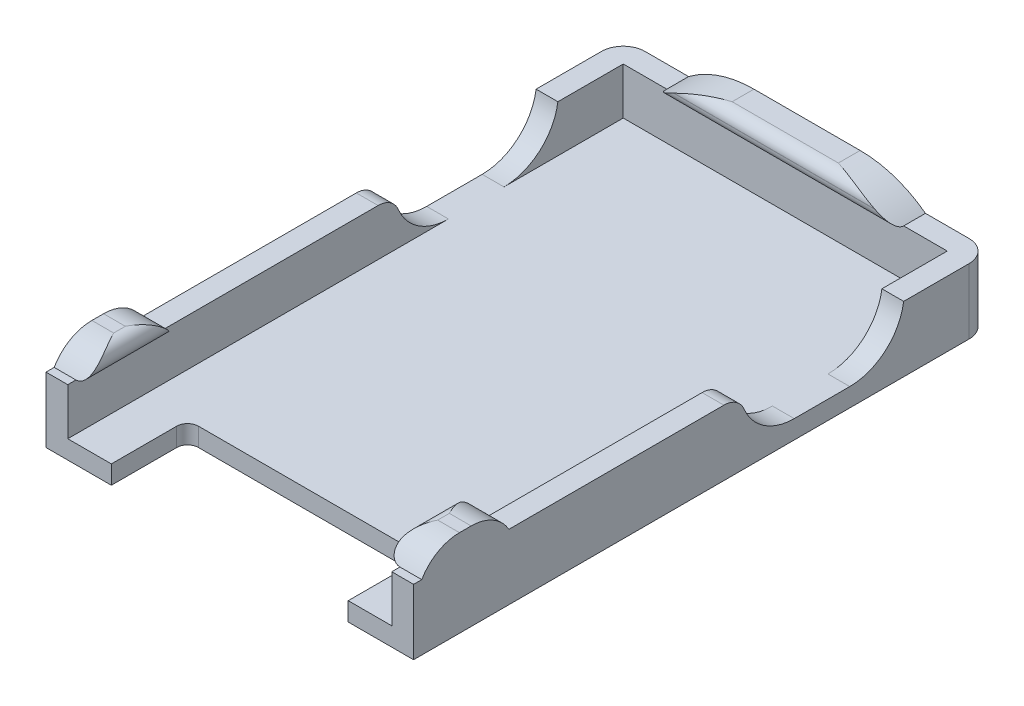
from build123d import *

# Parameters (mm, degrees)
SKETCH1_W               = 33.75000000000001
SKETCH1_H               = 55.99999999999999
SKETCH1_W_2             = 29.750000000000004
SKETCH1_H_2             = 52.00000000000001
BOSS_EXTRUDE1_DEPTH     = 6
BOSS_EXTRUDE2_DEPTH     = 1.7
SKETCH3_W               = 29.750000000000004
SKETCH3_H               = 4.3
CUT_EXTRUDE1_DEPTH      = 63.92902748334825
SKETCH5_W               = 21.750000000000004
SKETCH5_H               = 2.999999999999986
SKETCH5_W_2             = 2.9999999999999996
SKETCH5_H_2             = 8
BOSS_EXTRUDE3_DEPTH     = 2
CUT_EXTRUDE2_DEPTH      = 62.66137364671663
CUT_EXTRUDE2_DEPTH_BACK = 62.66137364671663
CUT_EXTRUDE3_DEPTH      = 62.66137364671663
CUT_EXTRUDE3_DEPTH_BACK = 62.66137364671663
CUT_EXTRUDE4_START      = -21.75
CUT_EXTRUDE4_DEPTH      = 21.75
FILLET1_R               = 10
FILLET2_R               = 4
CUT_EXTRUDE5_DEPTH      = 65.17992314238798
SKETCH12_W              = 21.750000000000004
SKETCH12_H              = 6.999999999999999
CUT_EXTRUDE6_DEPTH      = 63.958339642557306
FILLET4_R               = 2
FILLET5_R               = 1
CUT_EXTRUDE7_DEPTH      = 64.15110873264877
CUT_EXTRUDE7_DEPTH_BACK = 64.15110873264877
SKETCH13_W              = 14.999999999999996
SKETCH13_H              = 4.300000000000001
FILLET6_R               = 5
FILLET7_R               = 2


# Read off the part's stored shape, not the designer's step: Cut-Extrude4
with BuildPart() as part:
    # Sketch1 → Boss-Extrude1 (new body)
    with BuildSketch(Plane(origin=(0, 0, 0), x_dir=(1, 0, 0), z_dir=(0, 1, 0))):
        with Locations((14.875000000000002, 25.999999999999996)):
            Rectangle(SKETCH1_W, SKETCH1_H)
        with Locations((14.875000000000002, 26.000000000000004)):
            Rectangle(SKETCH1_W_2, SKETCH1_H_2, mode=Mode.SUBTRACT)
    extrude(amount=BOSS_EXTRUDE1_DEPTH)

    # Sketch2 → Boss-Extrude2 (add)
    with BuildSketch(Plane.XZ):
        Polygon((-1.9999999999999996, 2), (31.749999999999993, 2), (31.75, -53.99999999999999), (-1.9999999999999927, -53.99999999999999), align=None)
    extrude(amount=-BOSS_EXTRUDE2_DEPTH)

    # Sketch3 → Cut-Extrude1 (cut, through all)
    with BuildSketch(Plane(origin=(0, 0, 0), x_dir=(-1, 0, 0), z_dir=(0, 0, -1))):
        with Locations((-14.875000000000002, 3.85)):
            Rectangle(SKETCH3_W, SKETCH3_H)
    extrude(amount=-CUT_EXTRUDE1_DEPTH, mode=Mode.SUBTRACT)

    # Sketch5 → Boss-Extrude3 (add)
    with BuildSketch(Plane(origin=(0, 6, 0), x_dir=(1, 0, 0), z_dir=(0, 1, 0))):
        with Locations((14.875000000000002, 52.5)):
            Rectangle(SKETCH5_W, SKETCH5_H)
        with Locations((-0.4999999999999998, 5.75)):
            Rectangle(SKETCH5_W_2, SKETCH5_H_2)
        Polygon((31.750000000000014, 9.750000000000004), (28.75000000000001, 9.750000000000004), (28.750000000000014, 1.7500000000000033), (31.75000000000002, 1.750000000000004), align=None)
    extrude(amount=BOSS_EXTRUDE3_DEPTH)

    # Sketch6 → Cut-Extrude2 (cut, two sides: drawn at the far end of the back side and taken through both)
    with BuildSketch(Plane.XY.offset(-1.7499999999999998).offset(-CUT_EXTRUDE2_DEPTH_BACK)):
        with BuildLine():
            Line((1, 8), (0, 8))
            ThreePointArc((0, 8), (0.7071067811865474, 7.707106781186548), (1.0000000000000002, 7.000000000000001))
            Line((1, 7.000000000000001), (1, 8))
        make_face()
        with BuildLine():
            Line((1, 6), (1, 7.000000000000001))
            ThreePointArc((1.0000000000000002, 7.000000000000001), (0.7071067811865479, 6.292893218813453), (1.2e-16, 6))
            Line((0, 6), (1, 6))
        make_face()
    extrude(amount=CUT_EXTRUDE2_DEPTH + CUT_EXTRUDE2_DEPTH_BACK, mode=Mode.SUBTRACT)

    # Sketch7 → Cut-Extrude3 (cut, two sides: drawn at the far end of the back side and taken through both)
    with BuildSketch(Plane.XY.offset(-1.749999999999997).offset(-CUT_EXTRUDE3_DEPTH_BACK)):
        with BuildLine():
            Line((28.750000000000014, 6), (29.75, 6))
            ThreePointArc((29.75, 6), (29.042893218813454, 6.292893218813452), (28.75, 7))
            Line((28.750000000000014, 7), (28.750000000000014, 6))
        make_face()
        with BuildLine():
            Line((28.750000000000014, 8), (28.750000000000014, 7))
            ThreePointArc((28.75, 7), (29.042893218813454, 7.707106781186548), (29.75, 8))
            Line((29.75, 8), (28.750000000000014, 8))
        make_face()
    extrude(amount=CUT_EXTRUDE3_DEPTH + CUT_EXTRUDE3_DEPTH_BACK, mode=Mode.SUBTRACT)

    # Cut-Extrude4 outline → Cut-Extrude4 (cut)
    with BuildSketch(Plane.ZY.offset(-4).offset(CUT_EXTRUDE4_START)):
        with BuildLine():
            Line((-51, 6), (-51, 6.99))
            ThreePointArc((-51, 6.99), (-51.296387635, 6.289366479), (-51.99995, 5.999999999))
            Line((-51.99995, 5.999999999), (-51, 6))
        make_face()
        with BuildLine():
            ThreePointArc((-51.99995, 8.000000001), (-51.296387635, 7.710633521), (-51, 7.01))
            Line((-51, 7.01), (-51, 8))
            Line((-51, 8), (-51.99995, 8.000000001))
        make_face()
    extrude(amount=CUT_EXTRUDE4_DEPTH, mode=Mode.SUBTRACT)

    # Fillet1
    # the kernel refuses this fillet: 10 mm, written as the material it takes off along each edge
    with BuildSketch(Plane(origin=(4, 8, -36.99994999999842), x_dir=(1.1324e-13, -1, 0), z_dir=(0, 0, -1))) as fillet1_piece_1:
        with BuildLine():
            CenterArc((10.000000000000679, -5.999999999999498), FILLET1_R, 143.13010235415956, 36.86989764584689)
            Line((6.7946e-13, -6.000000000000631), (-0.19999999999931983, -6.000000000000653))
            Line((-0.19999999999931983, -6.000000000000653), (-0.1999999999999993, -2.265e-14))
            Line((-0.1999999999999993, -2.265e-14), (-2.265e-14, 0.20000000000000018))
            ThreePointArc((-2.265e-14, 0.20000000000000018), (1.0000000000001283, 0.20000000000011342), (1.8400000000002954, 0.11999999999998998))
            Line((1.8400000000002954, 0.11999999999998998), (2.000000000000303, 0))
        make_face()
    extrude(amount=32.00005000000314, mode=Mode.SUBTRACT)
    with BuildSketch(Plane(origin=(25.750000000000004, 8, -69.00000000000158), x_dir=(-1, 0, 0), z_dir=(0, 0, 1))) as fillet1_piece_2:
        with BuildLine():
            CenterArc((6.000000000000632, 10), FILLET1_R, 233.13010235415308, 36.86989764584689)
            Line((2.2737e-13, 2.0000000000003038), (-0.11999999999978073, 1.8400000000003098))
            ThreePointArc((-0.11999999999978073, 1.8400000000003098), (-0.1999999999999993, 1.0000000000001519), (-0.1999999999999993, 0))
            Line((-0.1999999999999993, 0), (0, -0.1999999999999993))
            Line((0, -0.1999999999999993), (6.000000000000632, -0.1999999999999993))
            Line((6.000000000000632, -0.1999999999999993), (6.000000000000632, 0))
        make_face()
    extrude(amount=32.00005000000316, mode=Mode.SUBTRACT)

    # Fillet2
    # the kernel refuses this fillet: 4 mm, written as the material it takes off along each edge
    with BuildSketch(Plane(origin=(8.66025403784487, 8, -9.75), x_dir=(0, -1, 7.283e-14), z_dir=(-1, 0, 0))) as fillet2_piece_1:
        with BuildLine():
            CenterArc((4.000000000000252, 3.4641016151376567), FILLET2_R, 179.99999999999582, 60.000000000001364)
            Line((2.5229e-13, 3.464101615137948), (-0.07999999999974777, 3.464101615137954))
            Line((-0.07999999999974777, 3.464101615137954), (-0.08000000000000007, 5.83e-15))
            Line((-0.08000000000000007, 5.83e-15), (-5.83e-15, -0.08000000000000007))
            ThreePointArc((-5.83e-15, -0.08000000000000007), (1.000000000000036, -0.0800000000000729), (1.9600000000000801, -0.06928203230275251))
            Line((1.9600000000000801, -0.06928203230275251), (2.0000000000000835, 0))
        make_face()
    extrude(amount=19.32050807568974, mode=Mode.SUBTRACT)
    with BuildSketch(Plane(origin=(-10.66025403784487, 8, -1.7499999999999998), x_dir=(0, -1, -7.25e-14), z_dir=(1, 0, 0))) as fillet2_piece_2:
        with BuildLine():
            CenterArc((4.000000000000251, 3.464101615137658), FILLET2_R, 179.99999999999585, 60.000000000001364)
            Line((2.5114e-13, 3.464101615137948), (-0.07999999999974894, 3.464101615137954))
            Line((-0.07999999999974894, 3.464101615137954), (-0.08000000000000007, 5.8e-15))
            Line((-0.08000000000000007, 5.8e-15), (-5.8e-15, -0.08000000000000007))
            ThreePointArc((-5.8e-15, -0.08000000000000007), (1.000000000000036, -0.08000000000007257), (1.9600000000000801, -0.06928203230275319))
            Line((1.9600000000000801, -0.06928203230275319), (2.0000000000000835, 0))
        make_face()
    extrude(amount=19.32050807568974, mode=Mode.SUBTRACT)
    with BuildSketch(Plane(origin=(40.41025403784491, 8, -9.750000000000004), x_dir=(0, -1, 7.55e-14), z_dir=(-1, 0, 0))) as fillet2_piece_3:
        with BuildLine():
            CenterArc((4.000000000000261, 3.464101615137654), FILLET2_R, 179.99999999999568, 60.00000000000142)
            Line((2.6152e-13, 3.464101615137956), (-0.07999999999973854, 3.464101615137962))
            Line((-0.07999999999973854, 3.464101615137962), (-0.08000000000000007, 6.04e-15))
            Line((-0.08000000000000007, 6.04e-15), (-6.04e-15, -0.08000000000000007))
            ThreePointArc((-6.04e-15, -0.08000000000000007), (1.0000000000000375, -0.08000000000007557), (1.9600000000000835, -0.0692820323027524))
            Line((1.9600000000000835, -0.0692820323027524), (2.000000000000087, 0))
        make_face()
    extrude(amount=19.320508075689798, mode=Mode.SUBTRACT)
    with BuildSketch(Plane(origin=(21.08974596215511, 8, -1.7500000000000018), x_dir=(-2.2e-16, 0, -1), z_dir=(1, 0, -2.2e-16))) as fillet2_piece_4:
        with BuildLine():
            CenterArc((3.464101615137956, -4), FILLET2_R, 90, 60.00000000000145)
            Line((1.5055e-13, -2.000000000000087), (-0.06928203230260555, -1.9600000000000888))
            ThreePointArc((-0.06928203230260555, -1.9600000000000888), (-0.0800000000000003, -1.0000000000000435), (-0.08000000000000007, 0))
            Line((-0.08000000000000007, 0), (0, 0.08000000000000007))
            Line((0, 0.08000000000000007), (3.464101615137956, 0.08000000000000007))
            Line((3.464101615137956, 0.08000000000000007), (3.464101615137956, 0))
        make_face()
    extrude(amount=19.320508075689798, mode=Mode.SUBTRACT)

    # Sketch11 → Cut-Extrude5 (cut, through all)
    with BuildSketch(Plane.ZY.offset(2.000000000000001)):
        Polygon((2, 6), (-1, 6), (-1.0000000000000009, 0), (2, 0), align=None)
    extrude(amount=-CUT_EXTRUDE5_DEPTH, mode=Mode.SUBTRACT)

    # Sketch12 → Cut-Extrude6 (cut, through all)
    with BuildSketch(Plane(origin=(0, 1.7, 0), x_dir=(1, 0, 0), z_dir=(0, 1, 0))):
        with Locations((14.875000000000002, 4.5)):
            Rectangle(SKETCH12_W, SKETCH12_H)
    extrude(amount=-CUT_EXTRUDE6_DEPTH, mode=Mode.SUBTRACT)

    # Fillet4
    fillet4_edges = [part.edges().sort_by_distance(p)[0] for p in [
        (-1.9999999999999987, 3, -53.99999999999999),
        (31.75, 3, -53.99999999999999),
    ]]
    fillet(fillet4_edges, radius=FILLET4_R)

    # Fillet5
    fillet5_edges = [part.edges().sort_by_distance(p)[0] for p in [
        (4, 0.85, -8),
        (25.75, 0.85, -8),
    ]]
    fillet(fillet5_edges, radius=FILLET5_R)

    # Sketch13 → Cut-Extrude7 (cut, two sides: drawn at the far end of the back side and taken through both)
    with BuildSketch(Plane(origin=(0, 0, 0), x_dir=(0, 0, -1), z_dir=(1, 0, 0)).offset(-CUT_EXTRUDE7_DEPTH_BACK)):
        with Locations((38.5, 3.8499999999999996)):
            Rectangle(SKETCH13_W, SKETCH13_H)
    extrude(amount=CUT_EXTRUDE7_DEPTH + CUT_EXTRUDE7_DEPTH_BACK, mode=Mode.SUBTRACT)

    # Fillet6
    # the kernel refuses this fillet: 5 mm, written as the material it adds along each edge
    with BuildSketch(Plane(origin=(31.75, 1.7, -46), x_dir=(0, 4e-17, 1), z_dir=(-1, 0, 0)), Plane(origin=(0, 1.7, -46), x_dir=(0, 4e-17, 1), z_dir=(-1, 0, 0))) as fillet6_piece_1:
        with BuildLine():
            CenterArc((4.9507575177946705, 5), FILLET6_R, 188.04784624731144, 81.95215375268856)
            Line((4.283e-14, 4.300000000000006), (-0.09901515035584632, 4.286000000000006))
            ThreePointArc((-0.09901515035584632, 4.286000000000006), (-0.10000000000000132, 2.150000000000003), (-0.10000000000000142, 0))
            Line((-0.10000000000000142, 0), (0, -0.10000000000000009))
            Line((0, -0.10000000000000009), (4.9507575177946705, -0.10000000000000009))
            Line((4.9507575177946705, -0.10000000000000009), (4.9507575177946705, 0))
        make_face()
    extrude(amount=2)
    with BuildSketch(Plane(origin=(29.75, 1.7, -31), x_dir=(0, 4e-17, -1), z_dir=(1, 0, 0)), Plane(origin=(-2, 1.7, -31), x_dir=(0, 4e-17, -1), z_dir=(1, 0, 0))) as fillet6_piece_2:
        with BuildLine():
            CenterArc((4.9507575177946705, 5), FILLET6_R, 188.04784624731144, 81.95215375268856)
            Line((4.283e-14, 4.300000000000006), (-0.09901515035584987, 4.286000000000006))
            ThreePointArc((-0.09901515035584987, 4.286000000000006), (-0.10000000000000132, 2.150000000000003), (-0.10000000000000142, 0))
            Line((-0.10000000000000142, 0), (0, -0.10000000000000009))
            Line((0, -0.10000000000000009), (4.9507575177946705, -0.10000000000000009))
            Line((4.9507575177946705, -0.10000000000000009), (4.9507575177946705, 0))
        make_face()
    extrude(amount=2)

    # Fillet7
    fillet7_edges = [part.edges().sort_by_distance(p)[0] for p in [
        (-1, 6, -31),
        (30.75, 6, -31),
    ]]
    fillet(fillet7_edges, radius=FILLET7_R)


solid = part.part
